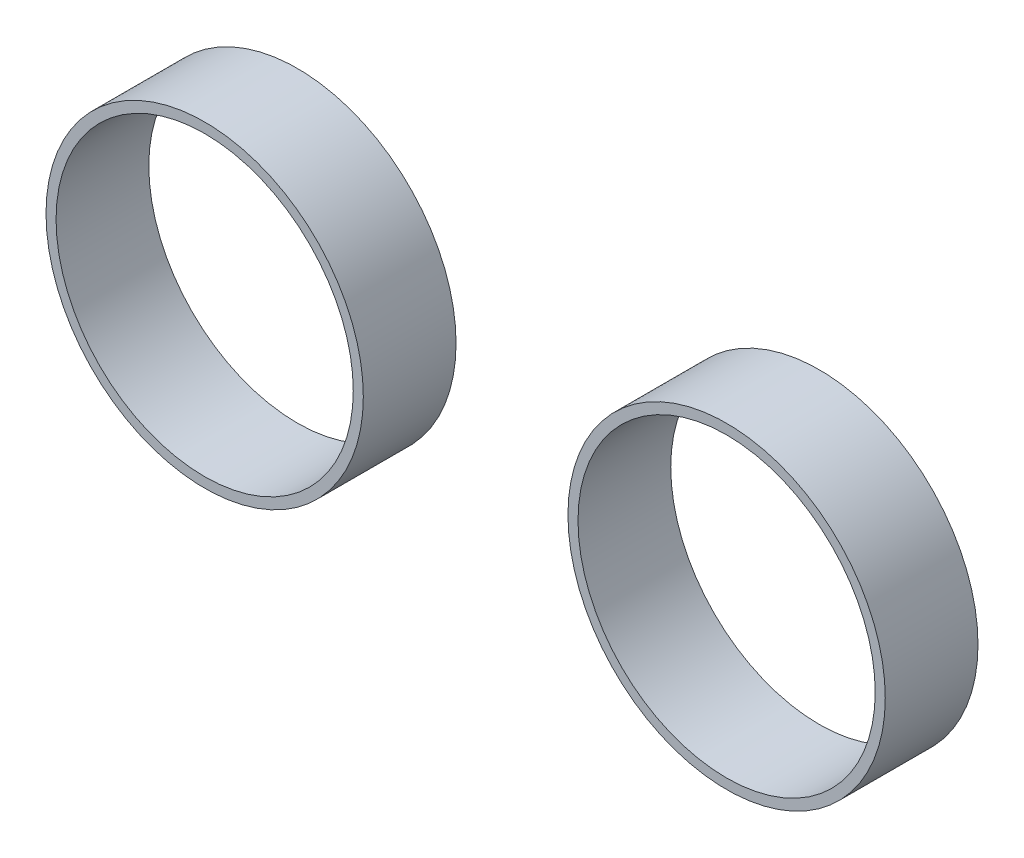
from build123d import *

# Parameters (mm, degrees)
SKETCH1_R             = 69.4
SKETCH1_R_2           = 65
BOSS_EXTRUDE1_DEPTH   = 40.56
BOSS_EXTRUDE1_2_DEPTH = 40.56


with BuildPart() as part:
    # Sketch1 → Boss-Extrude1 (new body)
    with BuildSketch(Plane.XY):
        with Locations((1664.280472759, -423.382336202)):
            Circle(SKETCH1_R)
        with Locations((1664.280472759, -423.382336202)):
            Circle(SKETCH1_R_2, mode=Mode.SUBTRACT)
    extrude(amount=BOSS_EXTRUDE1_DEPTH)


with BuildPart() as body_2:
    # Sketch1 → Boss-Extrude1 2 (new body)
    with BuildSketch(Plane.XY):
        with Locations((1435.980472759, -423.382336202)):
            Circle(SKETCH1_R)
        with Locations((1435.980472759, -423.382336202)):
            Circle(SKETCH1_R_2, mode=Mode.SUBTRACT)
    extrude(amount=BOSS_EXTRUDE1_2_DEPTH)


solid = Compound([part.part, body_2.part])
